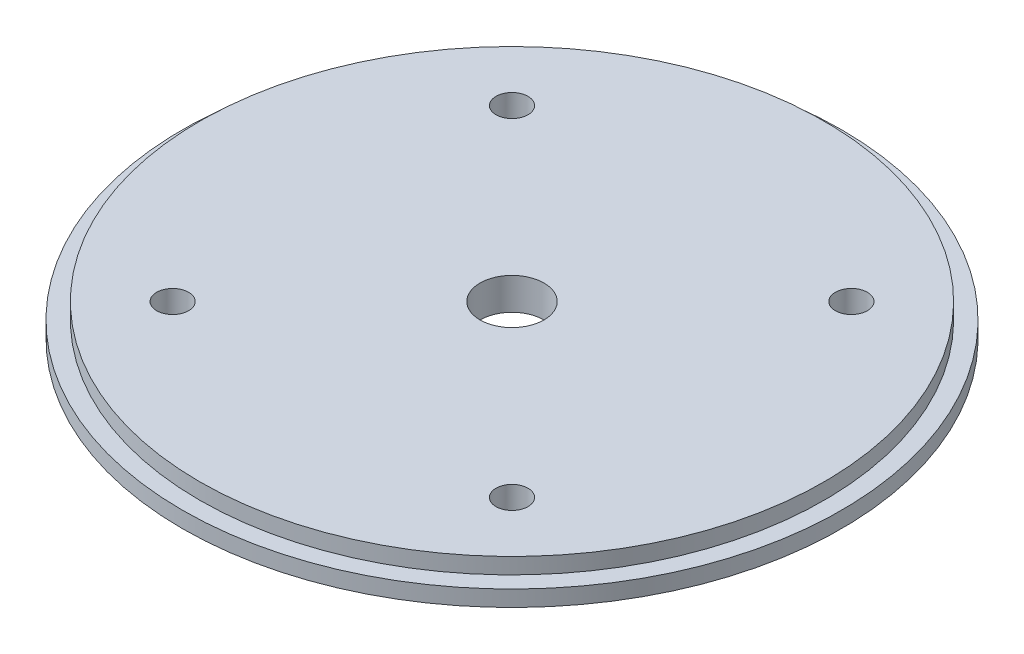
from build123d import *

# Parameters (mm, degrees)
SKETCH2_R                   = 65.405
BOSS_EXTRUDE1_DEPTH         = 6.35
CUT_EXTRUDE1_START          = -3.175
SKETCH4_R                   = 65.405
SKETCH4_R_2                 = 61.976
CUT_EXTRUDE1_DEPTH          = 3.175
F_1_4_0_25_DIAMETER_HOLE1_D = 6.35
F_1_2_0_5_DIAMETER_HOLE1_D  = 12.7
SKETCH9_R                   = 6.0325
CUT_EXTRUDE2_DEPTH          = 1.5875


with BuildPart() as part:
    # Sketch2 → Boss-Extrude1 (new body)
    with BuildSketch(Plane(origin=(0, 0, 0), x_dir=(1, 0, 0), z_dir=(0, 1, 0))):
        Circle(SKETCH2_R)
    extrude(amount=BOSS_EXTRUDE1_DEPTH)

    # Sketch4 → Cut-Extrude1 (cut)
    with BuildSketch(Plane(origin=(0, 6.35, 0), x_dir=(1, 0, 0), z_dir=(0, 1, 0)).offset(CUT_EXTRUDE1_START)):
        Circle(SKETCH4_R)
        Circle(SKETCH4_R_2, mode=Mode.SUBTRACT)
    extrude(amount=CUT_EXTRUDE1_DEPTH, mode=Mode.SUBTRACT)

    # 1/4 (0.25) Diameter Hole1 (through all)
    with Locations(Plane(origin=(0, 6.35, 0), x_dir=(1, 0, 0), z_dir=(0, 1, 0))):
        with Locations((-33.675960454, 33.675960454), (-33.675960454, -33.675960454), (33.675960454, 33.675960454), (33.675960454, -33.675960454)):
            Hole(F_1_4_0_25_DIAMETER_HOLE1_D / 2)

    # 1/2 (0.5) Diameter Hole1 (through all)
    with Locations(Plane(origin=(0, 6.35, 0), x_dir=(1, 0, 0), z_dir=(0, 1, 0))):
        with Locations((0, 0)):
            Hole(F_1_2_0_5_DIAMETER_HOLE1_D / 2)

    # Sketch9 → Cut-Extrude2 (cut)
    with BuildSketch(Plane.XZ):
        with Locations((-33.675960454, 33.675960454)):
            Circle(SKETCH9_R)
        with Locations((33.675960454, 33.675960454)):
            Circle(SKETCH9_R)
        with Locations((33.675960454, -33.675960454)):
            Circle(SKETCH9_R)
        with Locations((-33.675960454, -33.675960454)):
            Circle(SKETCH9_R)
    extrude(amount=-CUT_EXTRUDE2_DEPTH, mode=Mode.SUBTRACT)


solid = part.part
